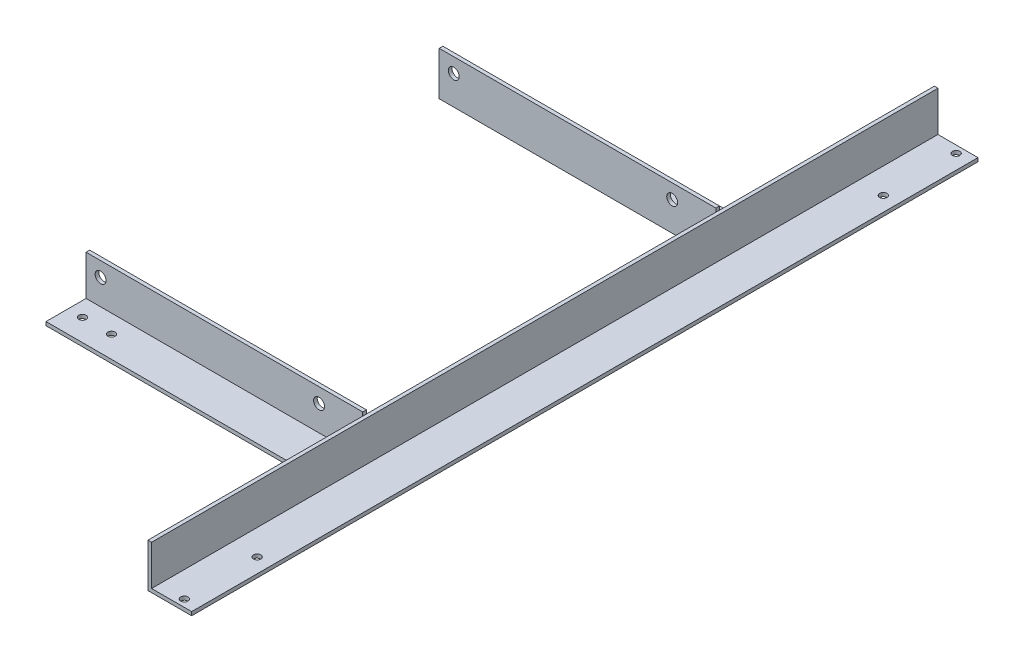
from build123d import *

# Parameters (mm, degrees)
EXTRUDE_THIN1_DEPTH     = 342.9
EXTRUDE_THIN2_DEPTH     = 241.3
CUT_EXTRUDE1_REACH      = 423.02
SKETCH3_R               = 3.175
CUT_EXTRUDE2_REACH      = 423.319
SKETCH4_R               = 3.175
CUT_EXTRUDE3_DEPTH      = 422.319030694
CUT_EXTRUDE3_DEPTH_BACK = 422.319030694
SKETCH5_R               = 4.7625


with BuildPart() as part:
    # Sketch1 → Extrude-Thin1 (new, symmetric)
    with BuildSketch(Plane.XY):
        Polygon((38.1, 0), (0, 0), (0, 38.1), (3.175, 38.1), (3.175, 3.175), (38.1, 3.175), align=None)
    extrude(amount=EXTRUDE_THIN1_DEPTH, both=True)

    # Sketch2 → Extrude-Thin2 (add)
    with BuildSketch(Plane.ZY):
        Polygon((-190.5, 3.175), (-152.4, 3.175), (-152.4, 41.275), (-155.575, 41.275), (-155.575, 6.35), (-190.5, 6.35), align=None)
        Polygon((190.5, 3.175), (152.4, 3.175), (152.4, 41.275), (155.575, 41.275), (155.575, 6.35), (190.5, 6.35), align=None)
    extrude(amount=EXTRUDE_THIN2_DEPTH)

    # Sketch3 → Cut-Extrude1 (cut, up to next)
    with BuildSketch(Plane.XZ.offset(-3.175), mode=Mode.PRIVATE) as cut_extrude1_sk1:
        with Locations((-228.6, 171.45)):
            Circle(SKETCH3_R)
    cut_extrude1_tool1 = extrude(cut_extrude1_sk1.sketch, amount=-CUT_EXTRUDE1_REACH, mode=Mode.PRIVATE) & part.part
    # Sketch3 → Cut-Extrude1 (cut, up to next)
    with BuildSketch(Plane.XZ.offset(-3.175), mode=Mode.PRIVATE) as cut_extrude1_sk2:
        with Locations((-203.2, 171.45)):
            Circle(SKETCH3_R)
    cut_extrude1_tool2 = extrude(cut_extrude1_sk2.sketch, amount=-CUT_EXTRUDE1_REACH, mode=Mode.PRIVATE) & part.part
    # Sketch3 → Cut-Extrude1 (cut, up to next)
    with BuildSketch(Plane.XZ.offset(-3.175), mode=Mode.PRIVATE) as cut_extrude1_sk3:
        with Locations((-228.6, -171.45)):
            Circle(SKETCH3_R)
    cut_extrude1_tool3 = extrude(cut_extrude1_sk3.sketch, amount=-CUT_EXTRUDE1_REACH, mode=Mode.PRIVATE) & part.part
    # Sketch3 → Cut-Extrude1 (cut, up to next)
    with BuildSketch(Plane.XZ.offset(-3.175), mode=Mode.PRIVATE) as cut_extrude1_sk4:
        with Locations((-203.2, -171.45)):
            Circle(SKETCH3_R)
    cut_extrude1_tool4 = extrude(cut_extrude1_sk4.sketch, amount=-CUT_EXTRUDE1_REACH, mode=Mode.PRIVATE) & part.part
    add(cut_extrude1_tool1.solids().sort_by_distance((-228.6, 3.175, 171.45))[0], mode=Mode.SUBTRACT)
    add(cut_extrude1_tool2.solids().sort_by_distance((-203.2, 3.175, 171.45))[0], mode=Mode.SUBTRACT)
    add(cut_extrude1_tool3.solids().sort_by_distance((-228.6, 3.175, -171.45))[0], mode=Mode.SUBTRACT)
    add(cut_extrude1_tool4.solids().sort_by_distance((-203.2, 3.175, -171.45))[0], mode=Mode.SUBTRACT)

    # Sketch4 → Cut-Extrude2 (cut, up to next)
    with BuildSketch(Plane.XZ, mode=Mode.PRIVATE) as cut_extrude2_sk1:
        with Locations((25.4, -336.55)):
            Circle(SKETCH4_R)
    cut_extrude2_tool1 = extrude(cut_extrude2_sk1.sketch, amount=-CUT_EXTRUDE2_REACH, mode=Mode.PRIVATE) & part.part
    # Sketch4 → Cut-Extrude2 (cut, up to next)
    with BuildSketch(Plane.XZ, mode=Mode.PRIVATE) as cut_extrude2_sk2:
        with Locations((25.4, -273.05)):
            Circle(SKETCH4_R)
    cut_extrude2_tool2 = extrude(cut_extrude2_sk2.sketch, amount=-CUT_EXTRUDE2_REACH, mode=Mode.PRIVATE) & part.part
    # Sketch4 → Cut-Extrude2 (cut, up to next)
    with BuildSketch(Plane.XZ, mode=Mode.PRIVATE) as cut_extrude2_sk3:
        with Locations((25.4, 273.05)):
            Circle(SKETCH4_R)
    cut_extrude2_tool3 = extrude(cut_extrude2_sk3.sketch, amount=-CUT_EXTRUDE2_REACH, mode=Mode.PRIVATE) & part.part
    # Sketch4 → Cut-Extrude2 (cut, up to next)
    with BuildSketch(Plane.XZ, mode=Mode.PRIVATE) as cut_extrude2_sk4:
        with Locations((25.4, 336.55)):
            Circle(SKETCH4_R)
    cut_extrude2_tool4 = extrude(cut_extrude2_sk4.sketch, amount=-CUT_EXTRUDE2_REACH, mode=Mode.PRIVATE) & part.part
    add(cut_extrude2_tool1.solids().sort_by_distance((25.4, 0, -336.55))[0], mode=Mode.SUBTRACT)
    add(cut_extrude2_tool2.solids().sort_by_distance((25.4, 0, -273.05))[0], mode=Mode.SUBTRACT)
    add(cut_extrude2_tool3.solids().sort_by_distance((25.4, 0, 273.05))[0], mode=Mode.SUBTRACT)
    add(cut_extrude2_tool4.solids().sort_by_distance((25.4, 0, 336.55))[0], mode=Mode.SUBTRACT)

    # Sketch5 → Cut-Extrude3 (cut, two sides: drawn at the far end of the back side and taken through both)
    with BuildSketch(Plane.XY.offset(-CUT_EXTRUDE3_DEPTH_BACK)):
        with Locations((-228.6, 28.575)):
            Circle(SKETCH5_R)
        with Locations((-38.1, 28.575)):
            Circle(SKETCH5_R)
    extrude(amount=CUT_EXTRUDE3_DEPTH + CUT_EXTRUDE3_DEPTH_BACK, mode=Mode.SUBTRACT)


solid = part.part
